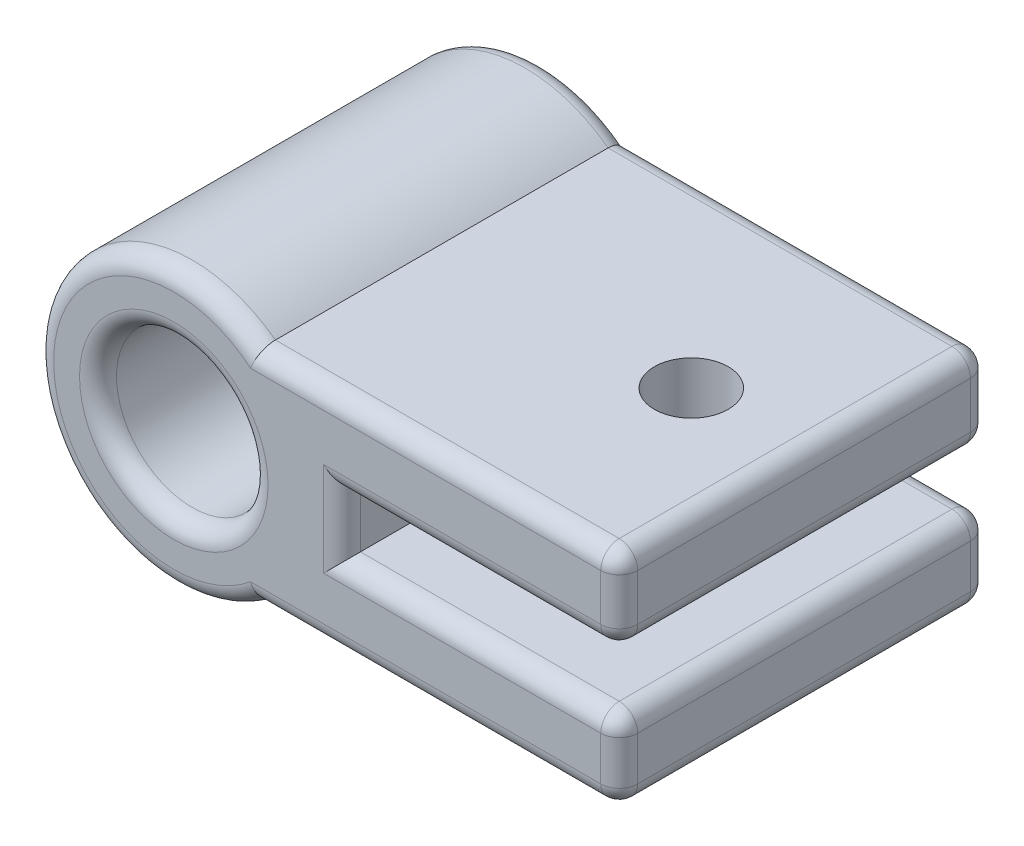
from build123d import *

# Parameters (mm, degrees)
SKETCH_1_R           = 7.5
SKETCH_1_R_2         = 4.1
EXTRUDE_1_DEPTH      = 20
EXTRUDE_2_DEPTH      = 6
EXTRUDE_2_DEPTH_BACK = 6
SKETCH_2_W           = 20
SKETCH_2_H           = 20
SKETCH_2_R           = 2
SKETCH_3_W           = 20
SKETCH_3_H           = 3.1
CUT_EXTRUDE_1_DEPTH  = 15
FILLET_1_R           = 1


with BuildPart() as part:
    # 草图1 → 凸台-拉伸1 (new body)
    with BuildSketch(Plane.XY):
        Circle(SKETCH_1_R)
        Circle(SKETCH_1_R_2, mode=Mode.SUBTRACT)
    extrude(amount=EXTRUDE_1_DEPTH)

    # 草图2 → 凸台-拉伸2 (add, two sides: drawn at the far end of the back side and taken through both)
    with BuildSketch(Plane(origin=(0, 0, 0), x_dir=(1, 0, 0), z_dir=(0, 1, 0)).offset(-EXTRUDE_2_DEPTH_BACK)):
        with Locations((14.1, -10)):
            Rectangle(SKETCH_2_W, SKETCH_2_H)
        with Locations((18, -10)):
            Circle(SKETCH_2_R, mode=Mode.SUBTRACT)
    extrude(amount=EXTRUDE_2_DEPTH + EXTRUDE_2_DEPTH_BACK)

    # 草图3 → 切除-拉伸1 (cut)
    with BuildSketch(Plane(origin=(24.1, 0, 0), x_dir=(0, 0, -1), z_dir=(1, 0, 0))):
        with Locations((-10, -0.077105761)):
            Rectangle(SKETCH_3_W, SKETCH_3_H)
    extrude(amount=-CUT_EXTRUDE_1_DEPTH, mode=Mode.SUBTRACT)

    # 圆角1
    fillet_1_edges = [part.edges().sort_by_distance(p)[0] for p in [
        (24.1, -6, 10),
        (24.1, -1.627105761, 10),
        (24.1, 6, 10),
        (24.1, 1.472894239, 10),
        (-4.1, 0, 0),
        (14.3, 6, 0),
        (-7.5, 0, 0),
        (14.3, -6, 0),
        (24.1, -3.81355288, 0),
        (16.6, -1.627105761, 0),
        (9.1, -0.077105761, 0),
        (16.6, 1.472894239, 0),
        (24.1, 3.73644712, 0),
        (-4.1, 0, 20),
        (9.1, -0.077105761, 20),
        (16.6, -1.627105761, 20),
        (24.1, -3.81355288, 20),
        (14.3, -6, 20),
        (-7.5, 0, 20),
        (14.3, 6, 20),
        (24.1, 3.73644712, 20),
        (16.6, 1.472894239, 20),
    ]]
    fillet(fillet_1_edges, radius=FILLET_1_R)


solid = part.part
